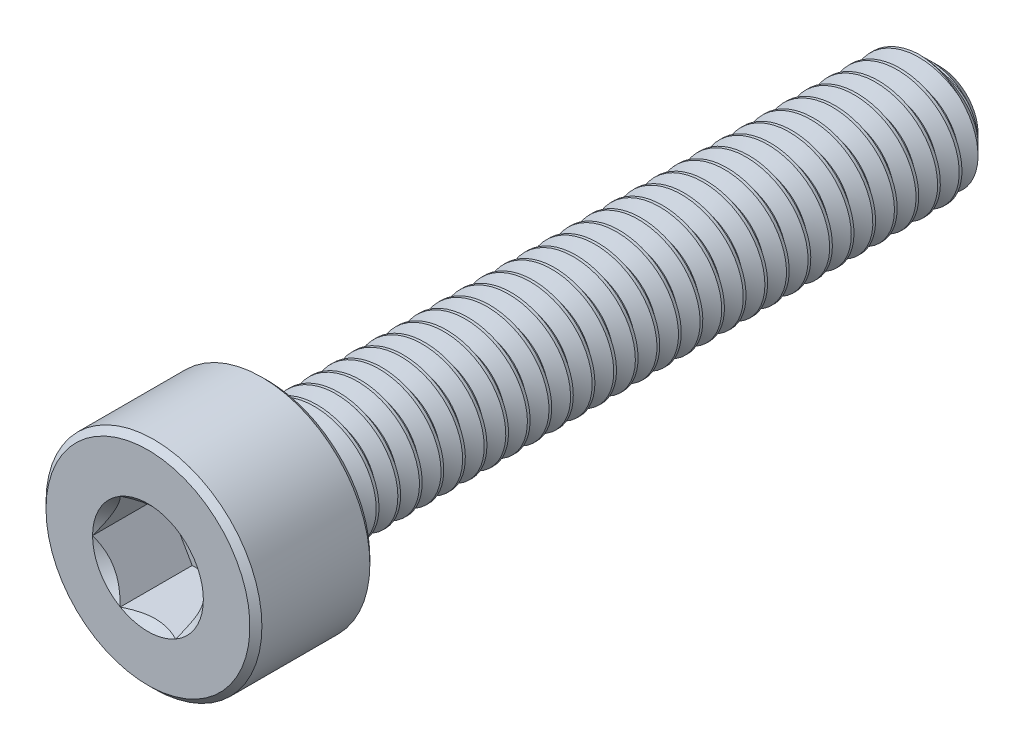
from build123d import *

# Parameters (mm, degrees)
CUT_EXTRUDE1_DEPTH = 1.5
CUT_SWEEP1_PITCH   = 0.45
CUT_SWEEP1_TO      = 14


with BuildPart() as part:
    # Sketch2 → Revolve1 (revolve)
    with BuildSketch(Plane(origin=(0, 0, 0), x_dir=(0, 0, -1), z_dir=(1, 0, 0)), mode=Mode.PRIVATE) as revolve1_sk:
        Polygon((-8.25, 0), (-8.25, 2.125), (-8.125, 2.25), (-5.875, 2.25), (-5.75, 2.125), (-5.75, 1.25), (7.8, 1.25), (8.25, 0.8), (8.25, 0), align=None)
    revolve(revolve1_sk.sketch.rotate(Axis((0, 0, -8.25), (0, 0, 1)), 90), axis=Axis((0, 0, -8.25), (0, 0, 1)))

    # Sketch3 → Cut-Extrude1 (cut)
    with BuildSketch(Plane.XY.offset(8.25)):
        Polygon((0.577350269, 1), (-0.577350269, 1), (-1.154700538, 0), (-0.577350269, -1), (0.577350269, -1), (1.154700538, 0), align=None)
    extrude(amount=-CUT_EXTRUDE1_DEPTH, mode=Mode.SUBTRACT)

    # Cut-Extrude2 cone 1 section (through the dimple's axis) → Cut-Extrude2 (revolve, cut)
    with BuildSketch(Plane(origin=(0, 0, 8.25), x_dir=(0, -1, 0), z_dir=(1, 0, 0))):
        Polygon((0, 0), (1.154700538, 0), (0, 1.154700538), align=None)
    revolve(axis=Axis((0, 0, 8.25), (0, 0, -1)), mode=Mode.SUBTRACT)


with BuildPart() as body_2:
    # Split1: read off the stored shape, not the designer's step
    # Split1: the piece on the far side of the plane
    add(part.part)
    split(bisect_by=Plane.XY.offset(5.75), keep=Keep.BOTTOM)

    # Cut-Sweep1: arcs per turn and ends read off the stored shape
    # Cut-Sweep1: the profile of Sketch7 screwed along a right-hand helix through 32.111111 turns, 6 arcs to a turn; built about Z, then put on its axis
    cut_sweep1_z = Axis((0, 0, 0), (0, 0, 1))
    cut_sweep1_corners = [(1.274356964, 0, 0.0140625), (1.274356964, 0, -0.4078125), (0.957716426, 0, -0.225), (0.957716426, 0, -0.16875)]
    with BuildLine(mode=Mode.PRIVATE) as cut_sweep1_profile:
        Line(cut_sweep1_corners[0], cut_sweep1_corners[1])
        Line(cut_sweep1_corners[1], cut_sweep1_corners[2])
        Line(cut_sweep1_corners[2], cut_sweep1_corners[3])
        Line(cut_sweep1_corners[3], cut_sweep1_corners[0])
    cut_sweep1_cap = Face(cut_sweep1_profile.wire())
    cut_sweep1_turn_angles = [0, 30, 60, 90, 120, 150, 180, 210, 240, 270, 300, 330, 360]
    cut_sweep1_turn_weights = [1, 0.8660254037844387, 1, 0.8660254037844387, 1, 0.8660254037844387, 1, 0.8660254037844387, 1, 0.8660254037844387, 1, 0.8660254037844387, 1]
    cut_sweep1_turn_rails = [Edge.make_bspline([Vector(p[0], p[1], 0).rotate(cut_sweep1_z, cut_sweep1_turn_angles[k]) / cut_sweep1_turn_weights[k] + Vector(0, 0, p[2] + CUT_SWEEP1_PITCH * cut_sweep1_turn_angles[k] / 360) for k in range(13)], [0, 0, 0, 1, 1, 2, 2, 3, 3, 4, 4, 5, 5, 6, 6, 6], 2, cut_sweep1_turn_weights) for p in cut_sweep1_corners]
    cut_sweep1_turn_sides = [Face.make_surface_from_curves(cut_sweep1_turn_rails[p[0]], cut_sweep1_turn_rails[p[1]]) for p in [(0, 1), (1, 2), (2, 3), (3, 0)]]
    cut_sweep1_last_angles = [11520, 11540, 11560]
    cut_sweep1_last_weights = [1, 0.9396926207859084, 1]
    cut_sweep1_last_rails = [Edge.make_bspline([Vector(p[0], p[1], 0).rotate(cut_sweep1_z, cut_sweep1_last_angles[k]) / cut_sweep1_last_weights[k] + Vector(0, 0, p[2] + CUT_SWEEP1_PITCH * cut_sweep1_last_angles[k] / 360) for k in range(3)], [0, 0, 0, 1, 1, 1], 2, cut_sweep1_last_weights) for p in cut_sweep1_corners]
    cut_sweep1_last_sides = [Face.make_surface_from_curves(cut_sweep1_last_rails[p[0]], cut_sweep1_last_rails[p[1]]) for p in [(0, 1), (1, 2), (2, 3), (3, 0)]]
    cut_sweep1 = Plane(origin=(0, 0, -8.25), x_dir=(0, 1, 0), z_dir=(0, 0, 1)) * split(Solid(Shell([*[p.moved(Location((0, 0, CUT_SWEEP1_PITCH * i))) for i in range(32) for p in cut_sweep1_turn_sides], *cut_sweep1_last_sides, cut_sweep1_cap, cut_sweep1_cap.rotate(cut_sweep1_z, 11560).moved(Location((0, 0, CUT_SWEEP1_PITCH * 11560 / 360)))])), bisect_by=Plane.XY.offset(CUT_SWEEP1_TO), keep=Keep.BOTTOM, mode=Mode.PRIVATE)
    add(cut_sweep1, mode=Mode.SUBTRACT)


with BuildPart() as part_1:
    add(part.part)

    # Split1
    split(bisect_by=Plane.XY.offset(5.75), keep=Keep.TOP)

    add(body_2.part)  # Boss-Extrude1 merges body 2
    # Boss-Extrude1: read off the stored shape, not the designer's step
    # Boss-Extrude1 outline → Boss-Extrude1 (revolve)
    with BuildSketch(Plane.XZ):
        Polygon((0.957711469, 5.75), (0.957711469, 5.646495203), (1.25, 5.75), align=None)
    revolve(axis=Axis((0, 0, 0), (0, 0, 1)))


solid = part_1.part
